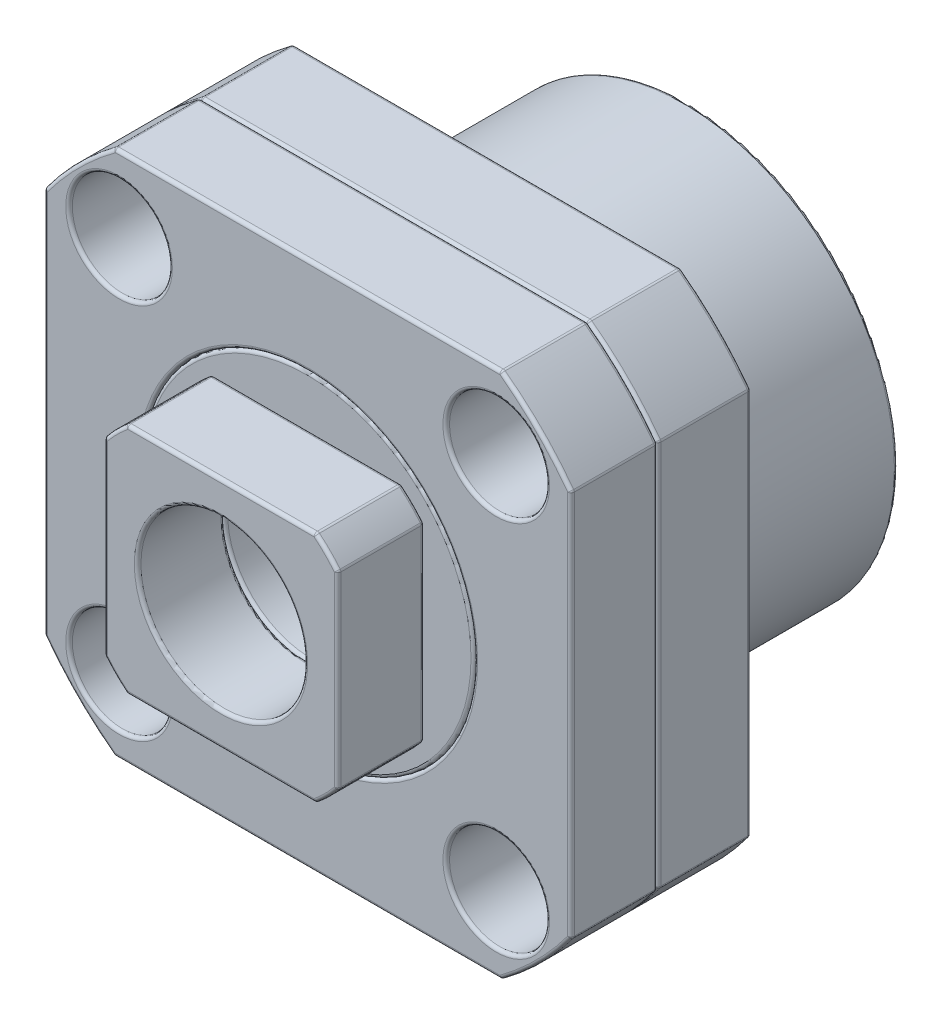
from build123d import *

# Parameters (mm, degrees)
SKETCH1_W            = 79
SKETCH1_H            = 79
SKETCH1_R            = 7.5
BOSS_EXTRUDE1_DEPTH  = 13
SKETCH2_OUTSIDE_W    = 103.496
SKETCH2_OUTSIDE_H    = 103.496
SKETCH2_OUTSIDE_R    = 49
CUT_EXTRUDE2_DEPTH   = 13
SKETCH3_R            = 26
BOSS_EXTRUDE2_DEPTH  = 1
SKETCH4_R            = 25
CUT_EXTRUDE3_DEPTH   = 14
SKETCH5_R            = 25
SKETCH5_R_2          = 12.5
BOSS_EXTRUDE4_DEPTH  = 14
FILLET1_R            = 0.5
SKETCH6_W            = 79
SKETCH6_H            = 79
SKETCH6_R            = 26
SKETCH6_R_2          = 4.5
BOSS_EXTRUDE5_DEPTH  = 14
SKETCH7_OUTSIDE_W    = 103.988
SKETCH7_OUTSIDE_H    = 103.988
SKETCH7_OUTSIDE_R    = 49
CUT_EXTRUDE5_DEPTH   = 14
SKETCH8_R            = 31.5
SKETCH8_R_2          = 26
BOSS_EXTRUDE6_DEPTH  = 30
BOSS_EXTRUDE7_START  = 10
SKETCH10_R           = 26
SKETCH10_R_2         = 25
BOSS_EXTRUDE7_DEPTH  = 10
SKETCH11_R           = 26
SKETCH11_R_2         = 12.5
BOSS_EXTRUDE8_DEPTH  = 30
FILLET2_R            = 0.5
SKETCH12_R           = 25
SKETCH12_R_2         = 12.5
BOSS_EXTRUDE9_DEPTH  = 14
FILLET3_R            = 0.5
FILLET4_R            = 0.5
SKETCH13_W           = 35
SKETCH13_H           = 35
BOSS_EXTRUDE10_DEPTH = 13
SKETCH14_OUTSIDE_W   = 107.368
SKETCH14_OUTSIDE_H   = 107.368
SKETCH14_OUTSIDE_R   = 22.5
CUT_EXTRUDE6_DEPTH   = 13
SKETCH15_R           = 12.5
CUT_EXTRUDE7_DEPTH   = 13
FILLET5_R            = 0.5
FILLET6_R            = 0.5


with BuildPart() as part:
    # Sketch1 → Boss-Extrude1 (new body)
    with BuildSketch(Plane.XY):
        Rectangle(SKETCH1_W, SKETCH1_H)
        with Locations((-28.284271247, -28.284271247)):
            Circle(SKETCH1_R, mode=Mode.SUBTRACT)
        with Locations((28.284271247, -28.284271247)):
            Circle(SKETCH1_R, mode=Mode.SUBTRACT)
        with Locations((28.284271247, 28.284271247)):
            Circle(SKETCH1_R, mode=Mode.SUBTRACT)
        with Locations((-28.284271247, 28.284271247)):
            Circle(SKETCH1_R, mode=Mode.SUBTRACT)
    extrude(amount=BOSS_EXTRUDE1_DEPTH)

    # Sketch2 outside → Cut-Extrude2 (cut)
    with BuildSketch(Plane.XY):
        Rectangle(SKETCH2_OUTSIDE_W, SKETCH2_OUTSIDE_H)
        Circle(SKETCH2_OUTSIDE_R, mode=Mode.SUBTRACT)
    extrude(amount=CUT_EXTRUDE2_DEPTH, mode=Mode.SUBTRACT)

    # Sketch3 → Boss-Extrude2 (add)
    with BuildSketch(Plane.XY):
        Circle(SKETCH3_R)
    extrude(amount=-BOSS_EXTRUDE2_DEPTH)

    # Sketch4 → Cut-Extrude3 (cut)
    with BuildSketch(Plane.XY.offset(13)):
        Circle(SKETCH4_R)
    extrude(amount=-CUT_EXTRUDE3_DEPTH, mode=Mode.SUBTRACT)

    # Fillet6
    fillet6_edges = [part.edges().sort_by_distance(p)[0] for p in [
        (-35.784271247, 28.284271247, 13),
        (20.784271247, -28.284271247, 13),
        (-35.784271247, -28.284271247, 13),
        (20.784271247, 28.284271247, 13),
        (-25, 0, 13),
        (-34.648232278, 34.648232278, 0),
        (-34.648232278, 34.648232278, 13),
        (-39.5, 28.995689335, 6.5),
        (-39.5, 0, 13),
        (-39.5, 0, 0),
        (-39.5, -28.995689335, 6.5),
        (-34.648232278, -34.648232278, 13),
        (-34.648232278, -34.648232278, 0),
        (-28.995689335, -39.5, 6.5),
        (0, -39.5, 13),
        (0, -39.5, 0),
        (28.995689335, -39.5, 6.5),
        (34.648232278, -34.648232278, 13),
        (34.648232278, -34.648232278, 0),
        (39.5, -28.995689335, 6.5),
        (39.5, 0, 13),
        (39.5, 0, 0),
        (39.5, 28.995689335, 6.5),
        (34.648232278, 34.648232278, 13),
        (34.648232278, 34.648232278, 0),
        (28.995689335, 39.5, 6.5),
        (0, 39.5, 13),
        (-28.995689335, 39.5, 6.5),
        (0, 39.5, 0),
    ]]
    fillet(fillet6_edges, radius=FILLET6_R)


with BuildPart() as body_2:
    # Sketch5 → Boss-Extrude4 (new body)
    with BuildSketch(Plane.XY.offset(13)):
        Circle(SKETCH5_R)
        Circle(SKETCH5_R_2, mode=Mode.SUBTRACT)
    extrude(amount=-BOSS_EXTRUDE4_DEPTH)

    # Fillet1
    fillet1_edges = [body_2.edges().sort_by_distance(p)[0] for p in [
        (-25, 0, 13),
        (-12.5, 0, 13),
        (-12.5, 0, -1),
        (-25, 0, -1),
    ]]
    fillet(fillet1_edges, radius=FILLET1_R)


with BuildPart() as body_3:
    # Sketch6 → Boss-Extrude5 (new body)
    with BuildSketch(Plane.XY):
        Rectangle(SKETCH6_W, SKETCH6_H)
        Circle(SKETCH6_R, mode=Mode.SUBTRACT)
        with Locations((-28.284271247, 28.284271247)):
            Circle(SKETCH6_R_2, mode=Mode.SUBTRACT)
        with Locations((28.284271247, 28.284271247)):
            Circle(SKETCH6_R_2, mode=Mode.SUBTRACT)
        with Locations((28.284271247, -28.284271247)):
            Circle(SKETCH6_R_2, mode=Mode.SUBTRACT)
        with Locations((-28.284271247, -28.284271247)):
            Circle(SKETCH6_R_2, mode=Mode.SUBTRACT)
    extrude(amount=-BOSS_EXTRUDE5_DEPTH)

    # Sketch7 outside → Cut-Extrude5 (cut)
    with BuildSketch(Plane.XY):
        Rectangle(SKETCH7_OUTSIDE_W, SKETCH7_OUTSIDE_H)
        Circle(SKETCH7_OUTSIDE_R, mode=Mode.SUBTRACT)
    extrude(amount=-CUT_EXTRUDE5_DEPTH, mode=Mode.SUBTRACT)

    # Sketch8 → Boss-Extrude6 (add)
    with BuildSketch(Plane.XY.offset(-14)):
        Circle(SKETCH8_R)
        Circle(SKETCH8_R_2, mode=Mode.SUBTRACT)
    extrude(amount=-BOSS_EXTRUDE6_DEPTH)

    # Sketch10 → Boss-Extrude7 (add)
    with BuildSketch(Plane.XY.offset(-44).offset(BOSS_EXTRUDE7_START)):
        Circle(SKETCH10_R)
        Circle(SKETCH10_R_2, mode=Mode.SUBTRACT)
    extrude(amount=-BOSS_EXTRUDE7_DEPTH)

    # Fillet4
    fillet4_edges = [body_3.edges().sort_by_distance(p)[0] for p in [
        (-25, 0, -44),
        (-31.5, 0, -44),
        (-31.5, 0, -14),
        (-34.648232278, 34.648232278, -14),
        (-34.648232278, 34.648232278, 0),
        (-39.5, 28.995689335, -7),
        (-39.5, 0, 0),
        (-39.5, 0, -14),
        (-39.5, -28.995689335, -7),
        (-34.648232278, -34.648232278, 0),
        (-34.648232278, -34.648232278, -14),
        (-28.995689335, -39.5, -7),
        (0, -39.5, 0),
        (0, -39.5, -14),
        (34.648232278, -34.648232278, -14),
        (28.995689335, -39.5, -7),
        (34.648232278, -34.648232278, 0),
        (39.5, -28.995689335, -7),
        (39.5, 0, 0),
        (39.5, 0, -14),
        (0, 39.5, 0),
        (-28.995689335, 39.5, -7),
        (0, 39.5, -14),
        (28.995689335, 39.5, -7),
        (34.648232278, 34.648232278, -14),
        (39.5, 28.995689335, -7),
        (34.648232278, 34.648232278, 0),
    ]]
    fillet(fillet4_edges, radius=FILLET4_R)


with BuildPart() as body_4:
    # Sketch11 → Boss-Extrude8 (new body)
    with BuildSketch(Plane.XY.offset(-1)):
        Circle(SKETCH11_R)
        Circle(SKETCH11_R_2, mode=Mode.SUBTRACT)
    extrude(amount=-BOSS_EXTRUDE8_DEPTH)

    # Fillet2
    fillet2_edges = [body_4.edges().sort_by_distance(p)[0] for p in [
        (-12.5, 0, -1),
        (-12.5, 0, -31),
    ]]
    fillet(fillet2_edges, radius=FILLET2_R)


with BuildPart() as body_5:
    # Sketch12 → Boss-Extrude9 (new body)
    with BuildSketch(Plane.XY.offset(-44)):
        Circle(SKETCH12_R)
        Circle(SKETCH12_R_2, mode=Mode.SUBTRACT)
    extrude(amount=BOSS_EXTRUDE9_DEPTH)

    # Fillet3
    fillet3_edges = [body_5.edges().sort_by_distance(p)[0] for p in [
        (-25, 0, -44),
        (-12.5, 0, -44),
        (-12.5, 0, -30),
    ]]
    fillet(fillet3_edges, radius=FILLET3_R)


with BuildPart() as body_6:
    # Sketch13 → Boss-Extrude10 (new body)
    with BuildSketch(Plane.XY.offset(13)):
        Rectangle(SKETCH13_W, SKETCH13_H)
    extrude(amount=BOSS_EXTRUDE10_DEPTH)

    # Sketch14 outside → Cut-Extrude6 (cut)
    with BuildSketch(Plane.XY.offset(26)):
        Rectangle(SKETCH14_OUTSIDE_W, SKETCH14_OUTSIDE_H)
        Circle(SKETCH14_OUTSIDE_R, mode=Mode.SUBTRACT)
    extrude(amount=-CUT_EXTRUDE6_DEPTH, mode=Mode.SUBTRACT)

    # Sketch15 → Cut-Extrude7 (cut)
    with BuildSketch(Plane.XY.offset(26)):
        Circle(SKETCH15_R)
    extrude(amount=-CUT_EXTRUDE7_DEPTH, mode=Mode.SUBTRACT)

    # Fillet5
    fillet5_edges = [body_6.edges().sort_by_distance(p)[0] for p in [
        (-12.5, 0, 26),
        (-12.5, 0, 13),
        (15.909902577, 15.909902577, 26),
        (15.909902577, 15.909902577, 13),
        (17.5, 0, 26),
        (17.5, 14.142135624, 19.5),
        (17.5, 0, 13),
        (15.909902577, -15.909902577, 26),
        (17.5, -14.142135624, 19.5),
        (15.909902577, -15.909902577, 13),
        (0, -17.5, 26),
        (14.142135624, -17.5, 19.5),
        (0, -17.5, 13),
        (-15.909902577, -15.909902577, 26),
        (-14.142135624, -17.5, 19.5),
        (-15.909902577, -15.909902577, 13),
        (-17.5, 0, 26),
        (-17.5, -14.142135624, 19.5),
        (-17.5, 0, 13),
        (0, 17.5, 26),
        (0, 17.5, 13),
        (14.142135624, 17.5, 19.5),
        (-15.909902577, 15.909902577, 13),
        (-14.142135624, 17.5, 19.5),
        (-15.909902577, 15.909902577, 26),
        (-17.5, 14.142135624, 19.5),
    ]]
    fillet(fillet5_edges, radius=FILLET5_R)


solid = Compound([part.part, body_2.part, body_3.part, body_4.part, body_5.part, body_6.part])
